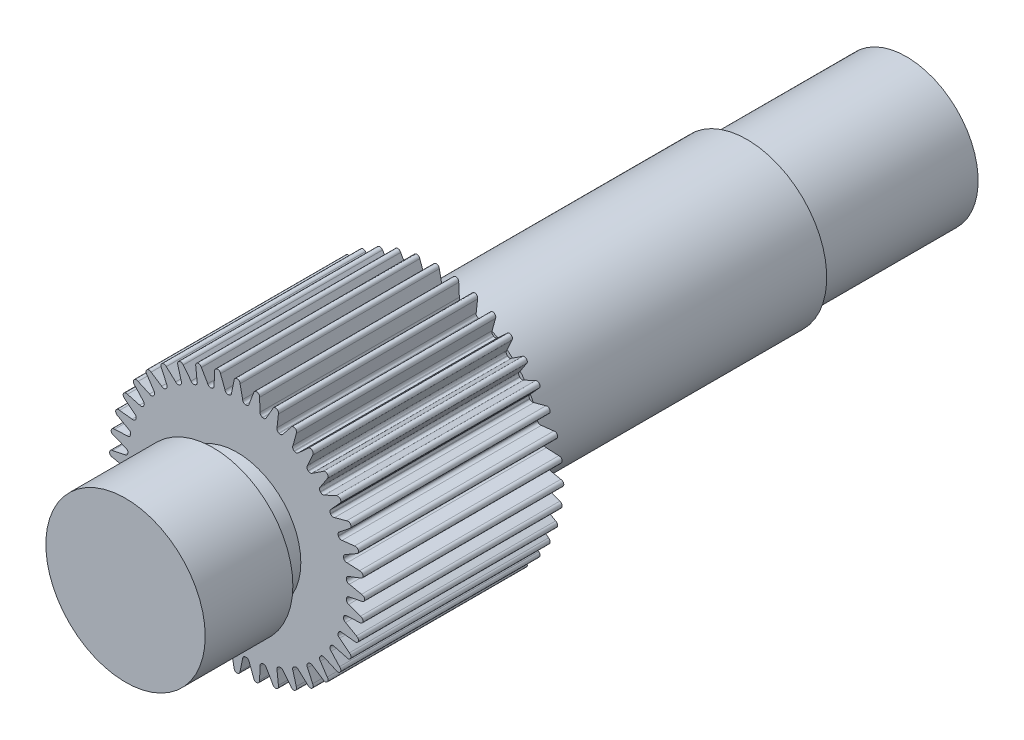
from build123d import *

# Parameters (mm, degrees)
SKETCH1_R            = 32
BOSS_EXTRUDE1_DEPTH  = 196
SKETCH2_OUTSIDE_W    = 109.178
SKETCH2_OUTSIDE_H    = 109.178
SKETCH2_OUTSIDE_R    = 20
CUT_EXTRUDE1_DEPTH   = 22
SKETCH3_OUTSIDE_W    = 109.178
SKETCH3_OUTSIDE_H    = 109.178
SKETCH3_OUTSIDE_R    = 16
CUT_EXTRUDE2_DEPTH   = 6
CUT_EXTRUDE3_START   = -197
CUT_EXTRUDE3_DEPTH   = 170
SKETCH5_OUTSIDE_W    = 109.178
SKETCH5_OUTSIDE_H    = 109.178
SKETCH5_OUTSIDE_R    = 20
CUT_EXTRUDE4_DEPTH   = 118
SKETCH6_OUTSIDE_W    = 109.178
SKETCH6_OUTSIDE_H    = 109.178
SKETCH6_OUTSIDE_R    = 18
CUT_EXTRUDE5_DEPTH   = 40
SKETCH7_OUTSIDE_W    = 109.178
SKETCH7_OUTSIDE_H    = 109.178
SKETCH7_OUTSIDE_R    = 16
CUT_EXTRUDE7_DEPTH   = 6
CUT_EXTRUDE9_START   = 18.731913592
CUT_EXTRUDE9_DEPTH   = 4.268086408
CUT_EXTRUDE9_START_2 = -14.500000017
CUT_EXTRUDE9_2_DEPTH = 0.708383551
CUT_EXTRUDE9_START_3 = 5.000000004
CUT_EXTRUDE9_3_DEPTH = 21.999999992


with BuildPart() as part:
    # Sketch1 → Boss-Extrude1 (new body)
    with BuildSketch(Plane.XY):
        Circle(SKETCH1_R)
    extrude(amount=BOSS_EXTRUDE1_DEPTH)

    # Sketch2 outside → Cut-Extrude1 (cut)
    with BuildSketch(Plane.XY.offset(196)):
        Rectangle(SKETCH2_OUTSIDE_W, SKETCH2_OUTSIDE_H)
        Circle(SKETCH2_OUTSIDE_R, mode=Mode.SUBTRACT)
    extrude(amount=-CUT_EXTRUDE1_DEPTH, mode=Mode.SUBTRACT)

    # Sketch3 outside → Cut-Extrude2 (cut)
    with BuildSketch(Plane.XY.offset(174)):
        Rectangle(SKETCH3_OUTSIDE_W, SKETCH3_OUTSIDE_H)
        Circle(SKETCH3_OUTSIDE_R, mode=Mode.SUBTRACT)
    extrude(amount=-CUT_EXTRUDE2_DEPTH, mode=Mode.SUBTRACT)

    # Cut-Extrude3: read off the stored shape, not the designer's step
    # Cut-Extrude3 outline → Cut-Extrude3 (cut)
    with BuildSketch(Plane.XY.offset(196).offset(CUT_EXTRUDE3_START)):
        with BuildLine():
            ThreePointArc((31.606026895, 5.005902904), (31.472023396, 4.447738103), (30.982586492, 4.147810777))
            Line((30.982586492, 4.147810777), (28.039781374, 3.02983001))
            ThreePointArc((28.039781374, 3.02983001), (27.567521523, 2.752624649), (27.409573402, 2.22829215))
            ThreePointArc((27.409573402, 2.22829215), (27.415226678, 2.157625132), (27.420697761, 2.086943776))
            ThreePointArc((27.420697761, 2.086943776), (27.658724952, 1.59377521), (28.168534972, 1.393860425))
            Line((28.168534972, 1.393860425), (31.25, 0.75))
            ThreePointArc((31.25, 0.75), (31.780330086, 0.530330086), (32, 0))
            ThreePointArc((32, 0), (31.901354679, 2.510691075), (31.606026895, 5.005902904))
        make_face()
        with BuildLine():
            ThreePointArc((30.747934795, 5.629343288), (31.306099573, 5.495339785), (31.606026895, 5.005902904))
            ThreePointArc((31.606026895, 5.005902904), (31.115837449, 7.47025166), (30.433808518, 9.88854383))
            ThreePointArc((30.433808518, 9.88854383), (30.388771029, 9.316288204), (29.95227888, 8.943488687))
            Line((29.95227888, 8.943488687), (27.220595299, 7.378915973))
            ThreePointArc((27.220595299, 7.378915973), (26.797514223, 7.031245754), (26.72353438, 6.488660128))
            ThreePointArc((26.72353438, 6.488660128), (26.740172811, 6.419747506), (26.756633536, 6.35079222))
            ThreePointArc((26.756633536, 6.35079222), (27.068878778, 5.900931034), (27.603685754, 5.783229389))
            Line((27.603685754, 5.783229389), (30.747934795, 5.629343288))
        make_face()
        with BuildLine():
            ThreePointArc((31.606026895, -5.005902904), (31.901354679, -2.510691075), (32, 0))
            ThreePointArc((32, 0), (31.780330086, -0.530330086), (31.25, -0.75))
            Line((31.25, -0.75), (28.168534972, -1.393860425))
            ThreePointArc((28.168534972, -1.393860425), (27.658724952, -1.59377521), (27.420697761, -2.086943776))
            ThreePointArc((27.420697761, -2.086943776), (27.415226678, -2.157625132), (27.409573402, -2.22829215))
            ThreePointArc((27.409573402, -2.22829215), (27.567521523, -2.752624649), (28.039781374, -3.02983001))
            Line((28.039781374, -3.02983001), (30.982586492, -4.147810777))
            ThreePointArc((30.982586492, -4.147810777), (31.472023396, -4.447738103), (31.606026895, -5.005902904))
        make_face()
        with BuildLine():
            ThreePointArc((29.488753388, 10.370073461), (30.061009004, 10.325035969), (30.433808518, 9.888543829))
            ThreePointArc((30.433808518, 9.888543829), (29.564145038, 12.24586984), (28.512208774, 14.527695992))
            ThreePointArc((28.512208774, 14.527695992), (28.557246268, 13.955440371), (28.184446756, 13.518948224))
            Line((28.184446756, 13.518948224), (25.731147828, 11.546308537))
            ThreePointArc((25.731147828, 11.546308537), (25.367663187, 11.136734253), (25.37947325, 10.589255759))
            ThreePointArc((25.37947325, 10.589255759), (25.406687144, 10.52379439), (25.433732193, 10.458263083))
            ThreePointArc((25.433732193, 10.458263083), (25.812506973, 10.062786352), (26.359142181, 10.030196053))
            Line((26.359142181, 10.030196053), (29.488753388, 10.370073461))
        make_face()
        with BuildLine():
            ThreePointArc((30.433808518, -9.88854383), (31.115837449, -7.47025166), (31.606026895, -5.005902904))
            ThreePointArc((31.606026895, -5.005902904), (31.306099573, -5.495339785), (30.747934795, -5.629343288))
            Line((30.747934795, -5.629343288), (27.603685754, -5.783229389))
            ThreePointArc((27.603685754, -5.783229389), (27.068878778, -5.900931034), (26.756633536, -6.35079222))
            ThreePointArc((26.756633536, -6.35079222), (26.740172811, -6.419747506), (26.72353438, -6.488660128))
            ThreePointArc((26.72353438, -6.488660128), (26.797514223, -7.031245754), (27.220595299, -7.378915973))
            Line((27.220595299, -7.378915973), (29.95227888, -8.943488687))
            ThreePointArc((29.95227888, -8.943488687), (30.388771029, -9.316288204), (30.433808518, -9.88854383))
        make_face()
        with BuildLine():
            ThreePointArc((27.503461006, 14.85545801), (28.075716627, 14.900495504), (28.512208774, 14.527695992))
            ThreePointArc((28.512208774, 14.527695992), (27.284485253, 16.719954081), (25.888543806, 18.809128093))
            ThreePointArc((25.888543806, 18.809128093), (26.022547331, 18.250963297), (25.722620013, 17.761526388))
            Line((25.722620013, 17.761526388), (23.6081141, 15.429392664))
            ThreePointArc((23.6081141, 15.429392664), (23.313176093, 14.967999393), (23.41048526, 14.42910877))
            ThreePointArc((23.41048526, 14.42910877), (23.44760452, 14.36871053), (23.484567955, 14.3082168))
            ThreePointArc((23.484567955, 14.3082168), (23.920545579, 13.976862473), (24.465549046, 14.030186001))
            Line((24.465549046, 14.030186001), (27.503461006, 14.85545801))
        make_face()
        with BuildLine():
            ThreePointArc((28.512208774, -14.527695992), (29.564145038, -12.24586984), (30.433808518, -9.88854383))
            ThreePointArc((30.433808518, -9.88854383), (30.061009004, -10.325035969), (29.488753388, -10.370073461))
            Line((29.488753388, -10.370073461), (26.359142181, -10.030196053))
            ThreePointArc((26.359142181, -10.030196053), (25.812506973, -10.062786352), (25.433732193, -10.458263083))
            ThreePointArc((25.433732193, -10.458263083), (25.406687144, -10.52379439), (25.37947325, -10.589255759))
            ThreePointArc((25.37947325, -10.589255759), (25.367663187, -11.136734253), (25.731147828, -11.546308537))
            Line((25.731147828, -11.546308537), (28.184446756, -13.518948224))
            ThreePointArc((28.184446756, -13.518948224), (28.557246268, -13.955440371), (28.512208774, -14.527695992))
        make_face()
        with BuildLine():
            ThreePointArc((24.840942135, 18.97505188), (25.399106911, 19.109055391), (25.888543805, 18.809128093))
            ThreePointArc((25.888543805, 18.809128093), (24.332990891, 20.782337556), (22.627416998, 22.627416998))
            ThreePointArc((22.627416998, 22.627416998), (22.847086912, 22.097086912), (22.627416998, 21.566756826))
            Line((22.627416998, 21.566756826), (20.903770253, 18.932553937))
            ThreePointArc((20.903770253, 18.932553937), (20.684641231, 18.430702714), (20.865053427, 17.913669235))
            ThreePointArc((20.865053427, 17.913669235), (20.911164054, 17.859821329), (20.957135712, 17.805854732))
            ThreePointArc((20.957135712, 17.805854732), (21.439580965, 17.546781854), (21.969532898, 17.684706207))
            Line((21.969532898, 17.684706207), (24.840942135, 18.97505188))
        make_face()
        with BuildLine():
            ThreePointArc((25.888543806, -18.809128093), (27.284485253, -16.719954081), (28.512208774, -14.527695992))
            ThreePointArc((28.512208774, -14.527695992), (28.075716627, -14.900495504), (27.503461006, -14.85545801))
            Line((27.503461006, -14.85545801), (24.465549046, -14.030186001))
            ThreePointArc((24.465549046, -14.030186001), (23.920545579, -13.976862473), (23.484567955, -14.3082168))
            ThreePointArc((23.484567955, -14.3082168), (23.44760452, -14.36871053), (23.41048526, -14.42910877))
            ThreePointArc((23.41048526, -14.42910877), (23.313176093, -14.967999393), (23.6081141, -15.429392664))
            Line((23.6081141, -15.429392664), (25.722620013, -17.761526388))
            ThreePointArc((25.722620013, -17.761526388), (26.022547331, -18.250963297), (25.888543806, -18.809128093))
        make_face()
        with BuildLine():
            ThreePointArc((21.566756826, 22.627416998), (22.097086912, 22.847086912), (22.627416998, 22.627416998))
            ThreePointArc((22.627416998, 22.627416998), (20.782337547, 24.332990899), (18.809128074, 25.88854382))
            ThreePointArc((18.809128074, 25.88854382), (19.10905539, 25.399106923), (18.97505188, 24.840942135))
            Line((18.97505188, 24.840942135), (17.684706207, 21.969532898))
            ThreePointArc((17.684706207, 21.969532898), (17.546781854, 21.439580965), (17.805854732, 20.957135712))
            ThreePointArc((17.805854732, 20.957135712), (17.859821329, 20.911164054), (17.913669235, 20.865053427))
            ThreePointArc((17.913669235, 20.865053427), (18.430702714, 20.684641231), (18.932553937, 20.903770253))
            Line((18.932553937, 20.903770253), (21.566756826, 22.627416998))
        make_face()
        with BuildLine():
            ThreePointArc((22.627416998, -22.627416998), (24.332990891, -20.782337556), (25.888543806, -18.809128093))
            ThreePointArc((25.888543806, -18.809128093), (25.399106911, -19.109055391), (24.840942135, -18.97505188))
            Line((24.840942135, -18.97505188), (21.969532898, -17.684706207))
            ThreePointArc((21.969532898, -17.684706207), (21.439580965, -17.546781854), (20.957135712, -17.805854732))
            ThreePointArc((20.957135712, -17.805854732), (20.911164054, -17.859821329), (20.865053427, -17.913669235))
            ThreePointArc((20.865053427, -17.913669235), (20.684641231, -18.430702714), (20.903770253, -18.932553937))
            Line((20.903770253, -18.932553937), (22.627416998, -21.566756826))
            ThreePointArc((22.627416998, -21.566756826), (22.847086912, -22.097086912), (22.627416998, -22.627416998))
        make_face()
        with BuildLine():
            ThreePointArc((17.761526388, 25.722620013), (18.250963285, 26.02254733), (18.809128074, 25.88854382))
            ThreePointArc((18.809128074, 25.88854382), (16.719954071, 27.284485259), (14.527695992, 28.512208774))
            ThreePointArc((14.527695992, 28.512208774), (14.900495504, 28.075716627), (14.85545801, 27.503461006))
            Line((14.85545801, 27.503461006), (14.030186001, 24.465549046))
            ThreePointArc((14.030186001, 24.465549046), (13.976862473, 23.920545579), (14.3082168, 23.484567955))
            ThreePointArc((14.3082168, 23.484567955), (14.36871053, 23.44760452), (14.42910877, 23.41048526))
            ThreePointArc((14.42910877, 23.41048526), (14.967999393, 23.313176093), (15.429392664, 23.6081141))
            Line((15.429392664, 23.6081141), (17.761526388, 25.722620013))
        make_face()
        with BuildLine():
            ThreePointArc((18.809128042, -25.888543843), (20.782337532, -24.332990912), (22.627416998, -22.627416998))
            ThreePointArc((22.627416998, -22.627416998), (22.097086912, -22.847086912), (21.566756826, -22.627416998))
            Line((21.566756826, -22.627416998), (18.932553937, -20.903770253))
            ThreePointArc((18.932553937, -20.903770253), (18.430702714, -20.684641231), (17.913669235, -20.865053427))
            ThreePointArc((17.913669235, -20.865053427), (17.859821329, -20.911164054), (17.805854732, -20.957135712))
            ThreePointArc((17.805854732, -20.957135712), (17.546781854, -21.439580965), (17.684706207, -21.969532898))
            Line((17.684706207, -21.969532898), (18.97505188, -24.840942135))
            ThreePointArc((18.97505188, -24.840942135), (19.109055386, -25.399106942), (18.809128042, -25.888543843))
        make_face()
        with BuildLine():
            ThreePointArc((13.518948224, 28.184446756), (13.955440371, 28.557246268), (14.527695992, 28.512208774))
            ThreePointArc((14.527695992, 28.512208774), (12.245869829, 29.564145043), (9.888543807, 30.433808526))
            ThreePointArc((9.888543807, 30.433808526), (10.325035964, 30.061009015), (10.370073461, 29.488753388))
            Line((10.370073461, 29.488753388), (10.030196053, 26.359142181))
            ThreePointArc((10.030196053, 26.359142181), (10.062786352, 25.812506973), (10.458263083, 25.433732193))
            ThreePointArc((10.458263083, 25.433732193), (10.52379439, 25.406687144), (10.589255759, 25.37947325))
            ThreePointArc((10.589255759, 25.37947325), (11.136734253, 25.367663187), (11.546308537, 25.731147828))
            Line((11.546308537, 25.731147828), (13.518948224, 28.184446756))
        make_face()
        with BuildLine():
            ThreePointArc((14.527695992, -28.512208774), (16.719954055, -27.284485269), (18.809128042, -25.888543843))
            ThreePointArc((18.809128042, -25.888543843), (18.250963266, -26.022547326), (17.761526388, -25.722620013))
            Line((17.761526388, -25.722620013), (15.429392664, -23.6081141))
            ThreePointArc((15.429392664, -23.6081141), (14.967999393, -23.313176093), (14.42910877, -23.41048526))
            ThreePointArc((14.42910877, -23.41048526), (14.36871053, -23.44760452), (14.3082168, -23.484567955))
            ThreePointArc((14.3082168, -23.484567955), (13.976862473, -23.920545579), (14.030186001, -24.465549046))
            Line((14.030186001, -24.465549046), (14.85545801, -27.503461006))
            ThreePointArc((14.85545801, -27.503461006), (14.900495504, -28.075716627), (14.527695992, -28.512208774))
        make_face()
        with BuildLine():
            ThreePointArc((8.943488687, 29.95227888), (9.316288193, 30.388771024), (9.888543807, 30.433808525))
            ThreePointArc((9.888543807, 30.433808525), (7.470251648, 31.115837452), (5.005902904, 31.606026895))
            ThreePointArc((5.005902904, 31.606026895), (5.495339785, 31.306099573), (5.629343288, 30.747934795))
            Line((5.629343288, 30.747934795), (5.783229389, 27.603685754))
            ThreePointArc((5.783229389, 27.603685754), (5.900931034, 27.068878778), (6.35079222, 26.756633536))
            ThreePointArc((6.35079222, 26.756633536), (6.419747506, 26.740172811), (6.488660128, 26.72353438))
            ThreePointArc((6.488660128, 26.72353438), (7.031245754, 26.797514223), (7.378915973, 27.220595299))
            Line((7.378915973, 27.220595299), (8.943488687, 29.95227888))
        make_face()
        with BuildLine():
            ThreePointArc((9.88854383, -30.433808518), (12.24586984, -29.564145038), (14.527695992, -28.512208774))
            ThreePointArc((14.527695992, -28.512208774), (13.955440371, -28.557246268), (13.518948224, -28.184446756))
            Line((13.518948224, -28.184446756), (11.546308537, -25.731147828))
            ThreePointArc((11.546308537, -25.731147828), (11.136734253, -25.367663187), (10.589255759, -25.37947325))
            ThreePointArc((10.589255759, -25.37947325), (10.52379439, -25.406687144), (10.458263083, -25.433732193))
            ThreePointArc((10.458263083, -25.433732193), (10.062786352, -25.812506973), (10.030196053, -26.359142181))
            Line((10.030196053, -26.359142181), (10.370073461, -29.488753388))
            ThreePointArc((10.370073461, -29.488753388), (10.325035969, -30.061009004), (9.88854383, -30.433808518))
        make_face()
        with BuildLine():
            ThreePointArc((4.147810777, 30.982586492), (4.447738103, 31.472023396), (5.005902904, 31.606026895))
            ThreePointArc((5.005902904, 31.606026895), (2.510691075, 31.901354679), (0, 32))
            ThreePointArc((0, 32), (0.530330086, 31.780330086), (0.75, 31.25))
            Line((0.75, 31.25), (1.393860425, 28.168534972))
            ThreePointArc((1.393860425, 28.168534972), (1.59377521, 27.658724952), (2.086943776, 27.420697761))
            ThreePointArc((2.086943776, 27.420697761), (2.157625132, 27.415226678), (2.22829215, 27.409573402))
            ThreePointArc((2.22829215, 27.409573402), (2.752624649, 27.567521523), (3.02983001, 28.039781374))
            Line((3.02983001, 28.039781374), (4.147810777, 30.982586492))
        make_face()
        with BuildLine():
            ThreePointArc((5.005902904, -31.606026895), (7.47025166, -31.115837449), (9.88854383, -30.433808518))
            ThreePointArc((9.88854383, -30.433808518), (9.316288204, -30.388771029), (8.943488687, -29.95227888))
            Line((8.943488687, -29.95227888), (7.378915973, -27.220595299))
            ThreePointArc((7.378915973, -27.220595299), (7.031245754, -26.797514223), (6.488660128, -26.72353438))
            ThreePointArc((6.488660128, -26.72353438), (6.419747506, -26.740172811), (6.35079222, -26.756633536))
            ThreePointArc((6.35079222, -26.756633536), (5.900931034, -27.068878778), (5.783229389, -27.603685754))
            Line((5.783229389, -27.603685754), (5.629343288, -30.747934795))
            ThreePointArc((5.629343288, -30.747934795), (5.495339785, -31.306099573), (5.005902904, -31.606026895))
        make_face()
        with BuildLine():
            ThreePointArc((-0.75, 31.25), (-0.530330086, 31.780330086), (0, 32))
            ThreePointArc((0, 32), (-2.510691075, 31.901354679), (-5.005902904, 31.606026895))
            ThreePointArc((-5.005902904, 31.606026895), (-4.447738103, 31.472023396), (-4.147810777, 30.982586492))
            Line((-4.147810777, 30.982586492), (-3.02983001, 28.039781374))
            ThreePointArc((-3.02983001, 28.039781374), (-2.752624649, 27.567521523), (-2.22829215, 27.409573402))
            ThreePointArc((-2.22829215, 27.409573402), (-2.157625132, 27.415226678), (-2.086943776, 27.420697761))
            ThreePointArc((-2.086943776, 27.420697761), (-1.59377521, 27.658724952), (-1.393860425, 28.168534972))
            Line((-1.393860425, 28.168534972), (-0.75, 31.25))
        make_face()
        with BuildLine():
            ThreePointArc((0, -32), (2.510691075, -31.901354679), (5.005902904, -31.606026895))
            ThreePointArc((5.005902904, -31.606026895), (4.447738103, -31.472023396), (4.147810777, -30.982586492))
            Line((4.147810777, -30.982586492), (3.02983001, -28.039781374))
            ThreePointArc((3.02983001, -28.039781374), (2.752624649, -27.567521523), (2.22829215, -27.409573402))
            ThreePointArc((2.22829215, -27.409573402), (2.157625132, -27.415226678), (2.086943776, -27.420697761))
            ThreePointArc((2.086943776, -27.420697761), (1.59377521, -27.658724952), (1.393860425, -28.168534972))
            Line((1.393860425, -28.168534972), (0.75, -31.25))
            ThreePointArc((0.75, -31.25), (0.530330086, -31.780330086), (0, -32))
        make_face()
        with BuildLine():
            ThreePointArc((-5.629343288, 30.747934795), (-5.495339785, 31.306099573), (-5.005902904, 31.606026895))
            ThreePointArc((-5.005902904, 31.606026895), (-7.47025166, 31.115837449), (-9.88854383, 30.433808518))
            ThreePointArc((-9.88854383, 30.433808518), (-9.316288204, 30.388771029), (-8.943488687, 29.95227888))
            Line((-8.943488687, 29.95227888), (-7.378915973, 27.220595299))
            ThreePointArc((-7.378915973, 27.220595299), (-7.031245754, 26.797514223), (-6.488660128, 26.72353438))
            ThreePointArc((-6.488660128, 26.72353438), (-6.419747506, 26.740172811), (-6.35079222, 26.756633536))
            ThreePointArc((-6.35079222, 26.756633536), (-5.900931034, 27.068878778), (-5.783229389, 27.603685754))
            Line((-5.783229389, 27.603685754), (-5.629343288, 30.747934795))
        make_face()
        with BuildLine():
            ThreePointArc((-5.005902904, -31.606026895), (-2.510691075, -31.901354679), (0, -32))
            ThreePointArc((0, -32), (-0.530330086, -31.780330086), (-0.75, -31.25))
            Line((-0.75, -31.25), (-1.393860425, -28.168534972))
            ThreePointArc((-1.393860425, -28.168534972), (-1.59377521, -27.658724952), (-2.086943776, -27.420697761))
            ThreePointArc((-2.086943776, -27.420697761), (-2.157625132, -27.415226678), (-2.22829215, -27.409573402))
            ThreePointArc((-2.22829215, -27.409573402), (-2.752624649, -27.567521523), (-3.02983001, -28.039781374))
            Line((-3.02983001, -28.039781374), (-4.147810777, -30.982586492))
            ThreePointArc((-4.147810777, -30.982586492), (-4.447738103, -31.472023396), (-5.005902904, -31.606026895))
        make_face()
        with BuildLine():
            ThreePointArc((-10.370073461, 29.488753388), (-10.325035969, 30.061009004), (-9.888543829, 30.433808518))
            ThreePointArc((-9.888543829, 30.433808518), (-12.24586984, 29.564145038), (-14.527695992, 28.512208774))
            ThreePointArc((-14.527695992, 28.512208774), (-13.955440371, 28.557246268), (-13.518948224, 28.184446756))
            Line((-13.518948224, 28.184446756), (-11.546308537, 25.731147828))
            ThreePointArc((-11.546308537, 25.731147828), (-11.136734253, 25.367663187), (-10.589255759, 25.37947325))
            ThreePointArc((-10.589255759, 25.37947325), (-10.52379439, 25.406687144), (-10.458263083, 25.433732193))
            ThreePointArc((-10.458263083, 25.433732193), (-10.062786352, 25.812506973), (-10.030196053, 26.359142181))
            Line((-10.030196053, 26.359142181), (-10.370073461, 29.488753388))
        make_face()
        with BuildLine():
            ThreePointArc((-9.88854383, -30.433808518), (-7.47025166, -31.115837449), (-5.005902904, -31.606026895))
            ThreePointArc((-5.005902904, -31.606026895), (-5.495339785, -31.306099573), (-5.629343288, -30.747934795))
            Line((-5.629343288, -30.747934795), (-5.783229389, -27.603685754))
            ThreePointArc((-5.783229389, -27.603685754), (-5.900931034, -27.068878778), (-6.35079222, -26.756633536))
            ThreePointArc((-6.35079222, -26.756633536), (-6.419747506, -26.740172811), (-6.488660128, -26.72353438))
            ThreePointArc((-6.488660128, -26.72353438), (-7.031245754, -26.797514223), (-7.378915973, -27.220595299))
            Line((-7.378915973, -27.220595299), (-8.943488687, -29.95227888))
            ThreePointArc((-8.943488687, -29.95227888), (-9.316288204, -30.388771029), (-9.88854383, -30.433808518))
        make_face()
        with BuildLine():
            ThreePointArc((-14.85545801, 27.503461006), (-14.900495504, 28.075716627), (-14.527695992, 28.512208774))
            ThreePointArc((-14.527695992, 28.512208774), (-16.719954081, 27.284485253), (-18.809128093, 25.888543806))
            ThreePointArc((-18.809128093, 25.888543806), (-18.250963297, 26.022547331), (-17.761526388, 25.722620013))
            Line((-17.761526388, 25.722620013), (-15.429392664, 23.6081141))
            ThreePointArc((-15.429392664, 23.6081141), (-14.967999393, 23.313176093), (-14.42910877, 23.41048526))
            ThreePointArc((-14.42910877, 23.41048526), (-14.36871053, 23.44760452), (-14.3082168, 23.484567955))
            ThreePointArc((-14.3082168, 23.484567955), (-13.976862473, 23.920545579), (-14.030186001, 24.465549046))
            Line((-14.030186001, 24.465549046), (-14.85545801, 27.503461006))
        make_face()
        with BuildLine():
            ThreePointArc((-14.527695992, -28.512208774), (-12.24586984, -29.564145038), (-9.88854383, -30.433808518))
            ThreePointArc((-9.88854383, -30.433808518), (-10.325035969, -30.061009004), (-10.370073461, -29.488753388))
            Line((-10.370073461, -29.488753388), (-10.030196053, -26.359142181))
            ThreePointArc((-10.030196053, -26.359142181), (-10.062786352, -25.812506973), (-10.458263083, -25.433732193))
            ThreePointArc((-10.458263083, -25.433732193), (-10.52379439, -25.406687144), (-10.589255759, -25.37947325))
            ThreePointArc((-10.589255759, -25.37947325), (-11.136734253, -25.367663187), (-11.546308537, -25.731147828))
            Line((-11.546308537, -25.731147828), (-13.518948224, -28.184446756))
            ThreePointArc((-13.518948224, -28.184446756), (-13.955440371, -28.557246268), (-14.527695992, -28.512208774))
        make_face()
        with BuildLine():
            ThreePointArc((-18.97505188, 24.840942135), (-19.109055391, 25.399106911), (-18.809128093, 25.888543805))
            ThreePointArc((-18.809128093, 25.888543805), (-20.782337556, 24.332990891), (-22.627416998, 22.627416998))
            ThreePointArc((-22.627416998, 22.627416998), (-22.097086912, 22.847086912), (-21.566756826, 22.627416998))
            Line((-21.566756826, 22.627416998), (-18.932553937, 20.903770253))
            ThreePointArc((-18.932553937, 20.903770253), (-18.430702714, 20.684641231), (-17.913669235, 20.865053427))
            ThreePointArc((-17.913669235, 20.865053427), (-17.859821329, 20.911164054), (-17.805854732, 20.957135712))
            ThreePointArc((-17.805854732, 20.957135712), (-17.546781854, 21.439580965), (-17.684706207, 21.969532898))
            Line((-17.684706207, 21.969532898), (-18.97505188, 24.840942135))
        make_face()
        with BuildLine():
            ThreePointArc((-18.809128042, -25.888543843), (-16.719954055, -27.284485269), (-14.527695992, -28.512208774))
            ThreePointArc((-14.527695992, -28.512208774), (-14.900495504, -28.075716627), (-14.85545801, -27.503461006))
            Line((-14.85545801, -27.503461006), (-14.030186001, -24.465549046))
            ThreePointArc((-14.030186001, -24.465549046), (-13.976862473, -23.920545579), (-14.3082168, -23.484567955))
            ThreePointArc((-14.3082168, -23.484567955), (-14.36871053, -23.44760452), (-14.42910877, -23.41048526))
            ThreePointArc((-14.42910877, -23.41048526), (-14.967999393, -23.313176093), (-15.429392664, -23.6081141))
            Line((-15.429392664, -23.6081141), (-17.761526388, -25.722620013))
            ThreePointArc((-17.761526388, -25.722620013), (-18.250963266, -26.022547326), (-18.809128042, -25.888543843))
        make_face()
        with BuildLine():
            ThreePointArc((-22.627416998, 21.566756826), (-22.847086912, 22.097086912), (-22.627416998, 22.627416998))
            ThreePointArc((-22.627416998, 22.627416998), (-24.332990912, 20.782337532), (-25.888543843, 18.809128042))
            ThreePointArc((-25.888543843, 18.809128042), (-25.399106942, 19.109055386), (-24.840942135, 18.97505188))
            Line((-24.840942135, 18.97505188), (-21.969532898, 17.684706207))
            ThreePointArc((-21.969532898, 17.684706207), (-21.439580965, 17.546781854), (-20.957135712, 17.805854732))
            ThreePointArc((-20.957135712, 17.805854732), (-20.911164054, 17.859821329), (-20.865053427, 17.913669235))
            ThreePointArc((-20.865053427, 17.913669235), (-20.684641231, 18.430702714), (-20.903770253, 18.932553937))
            Line((-20.903770253, 18.932553937), (-22.627416998, 21.566756826))
        make_face()
        with BuildLine():
            ThreePointArc((-22.627416998, -22.627416998), (-20.782337532, -24.332990912), (-18.809128042, -25.888543843))
            ThreePointArc((-18.809128042, -25.888543843), (-19.109055386, -25.399106942), (-18.97505188, -24.840942135))
            Line((-18.97505188, -24.840942135), (-17.684706207, -21.969532898))
            ThreePointArc((-17.684706207, -21.969532898), (-17.546781854, -21.439580965), (-17.805854732, -20.957135712))
            ThreePointArc((-17.805854732, -20.957135712), (-17.859821329, -20.911164054), (-17.913669235, -20.865053427))
            ThreePointArc((-17.913669235, -20.865053427), (-18.430702714, -20.684641231), (-18.932553937, -20.903770253))
            Line((-18.932553937, -20.903770253), (-21.566756826, -22.627416998))
            ThreePointArc((-21.566756826, -22.627416998), (-22.097086912, -22.847086912), (-22.627416998, -22.627416998))
        make_face()
        with BuildLine():
            ThreePointArc((-25.722620013, 17.761526388), (-26.022547326, 18.250963266), (-25.888543842, 18.809128042))
            ThreePointArc((-25.888543842, 18.809128042), (-27.284485269, 16.719954055), (-28.512208774, 14.527695992))
            ThreePointArc((-28.512208774, 14.527695992), (-28.075716627, 14.900495504), (-27.503461006, 14.85545801))
            Line((-27.503461006, 14.85545801), (-24.465549046, 14.030186001))
            ThreePointArc((-24.465549046, 14.030186001), (-23.920545579, 13.976862473), (-23.484567955, 14.3082168))
            ThreePointArc((-23.484567955, 14.3082168), (-23.44760452, 14.36871053), (-23.41048526, 14.42910877))
            ThreePointArc((-23.41048526, 14.42910877), (-23.313176093, 14.967999393), (-23.6081141, 15.429392664))
            Line((-23.6081141, 15.429392664), (-25.722620013, 17.761526388))
        make_face()
        with BuildLine():
            ThreePointArc((-25.888543828, -18.809128062), (-24.332990904, -20.782337541), (-22.627416998, -22.627416998))
            ThreePointArc((-22.627416998, -22.627416998), (-22.847086912, -22.097086912), (-22.627416998, -21.566756826))
            Line((-22.627416998, -21.566756826), (-20.903770253, -18.932553937))
            ThreePointArc((-20.903770253, -18.932553937), (-20.684641231, -18.430702714), (-20.865053427, -17.913669235))
            ThreePointArc((-20.865053427, -17.913669235), (-20.911164054, -17.859821329), (-20.957135712, -17.805854732))
            ThreePointArc((-20.957135712, -17.805854732), (-21.439580965, -17.546781854), (-21.969532898, -17.684706207))
            Line((-21.969532898, -17.684706207), (-24.840942135, -18.97505188))
            ThreePointArc((-24.840942135, -18.97505188), (-25.39910693, -19.109055388), (-25.888543828, -18.809128062))
        make_face()
        with BuildLine():
            ThreePointArc((-28.184446756, 13.518948224), (-28.557246268, 13.955440371), (-28.512208774, 14.527695992))
            ThreePointArc((-28.512208774, 14.527695992), (-29.564145038, 12.24586984), (-30.433808518, 9.88854383))
            ThreePointArc((-30.433808518, 9.88854383), (-30.061009004, 10.325035969), (-29.488753388, 10.370073461))
            Line((-29.488753388, 10.370073461), (-26.359142181, 10.030196053))
            ThreePointArc((-26.359142181, 10.030196053), (-25.812506973, 10.062786352), (-25.433732193, 10.458263083))
            ThreePointArc((-25.433732193, 10.458263083), (-25.406687144, 10.52379439), (-25.37947325, 10.589255759))
            ThreePointArc((-25.37947325, 10.589255759), (-25.367663187, 11.136734253), (-25.731147828, 11.546308537))
            Line((-25.731147828, 11.546308537), (-28.184446756, 13.518948224))
        make_face()
        with BuildLine():
            ThreePointArc((-28.512208774, -14.527695992), (-27.284485263, -16.719954065), (-25.888543828, -18.809128062))
            ThreePointArc((-25.888543828, -18.809128062), (-26.022547328, -18.250963278), (-25.722620013, -17.761526388))
            Line((-25.722620013, -17.761526388), (-23.6081141, -15.429392664))
            ThreePointArc((-23.6081141, -15.429392664), (-23.313176093, -14.967999393), (-23.41048526, -14.42910877))
            ThreePointArc((-23.41048526, -14.42910877), (-23.44760452, -14.36871053), (-23.484567955, -14.3082168))
            ThreePointArc((-23.484567955, -14.3082168), (-23.920545579, -13.976862473), (-24.465549046, -14.030186001))
            Line((-24.465549046, -14.030186001), (-27.503461006, -14.85545801))
            ThreePointArc((-27.503461006, -14.85545801), (-28.075716627, -14.900495504), (-28.512208774, -14.527695992))
        make_face()
        with BuildLine():
            ThreePointArc((-29.95227888, 8.943488687), (-30.388771029, 9.316288204), (-30.433808518, 9.888543829))
            ThreePointArc((-30.433808518, 9.888543829), (-31.115837454, 7.470251638), (-31.606026902, 5.005902861))
            ThreePointArc((-31.606026902, 5.005902861), (-31.306099591, 5.495339772), (-30.747934795, 5.629343288))
            Line((-30.747934795, 5.629343288), (-27.603685754, 5.783229389))
            ThreePointArc((-27.603685754, 5.783229389), (-27.068878778, 5.900931034), (-26.756633536, 6.35079222))
            ThreePointArc((-26.756633536, 6.35079222), (-26.740172811, 6.419747506), (-26.72353438, 6.488660128))
            ThreePointArc((-26.72353438, 6.488660128), (-26.797514223, 7.031245754), (-27.220595299, 7.378915973))
            Line((-27.220595299, 7.378915973), (-29.95227888, 8.943488687))
        make_face()
        with BuildLine():
            ThreePointArc((-30.433808518, -9.88854383), (-29.564145038, -12.24586984), (-28.512208774, -14.527695992))
            ThreePointArc((-28.512208774, -14.527695992), (-28.557246268, -13.955440371), (-28.184446756, -13.518948224))
            Line((-28.184446756, -13.518948224), (-25.731147828, -11.546308537))
            ThreePointArc((-25.731147828, -11.546308537), (-25.367663187, -11.136734253), (-25.37947325, -10.589255759))
            ThreePointArc((-25.37947325, -10.589255759), (-25.406687144, -10.52379439), (-25.433732193, -10.458263083))
            ThreePointArc((-25.433732193, -10.458263083), (-25.812506973, -10.062786352), (-26.359142181, -10.030196053))
            Line((-26.359142181, -10.030196053), (-29.488753388, -10.370073461))
            ThreePointArc((-29.488753388, -10.370073461), (-30.061009004, -10.325035969), (-30.433808518, -9.88854383))
        make_face()
        with BuildLine():
            ThreePointArc((-30.982586492, 4.147810777), (-31.472023383, 4.447738085), (-31.606026902, 5.005902861))
            ThreePointArc((-31.606026902, 5.005902861), (-31.90135468, 2.510691053), (-32, 0))
            ThreePointArc((-32, 0), (-31.780330086, 0.530330086), (-31.25, 0.75))
            Line((-31.25, 0.75), (-28.168534972, 1.393860425))
            ThreePointArc((-28.168534972, 1.393860425), (-27.658724952, 1.59377521), (-27.420697761, 2.086943776))
            ThreePointArc((-27.420697761, 2.086943776), (-27.415226678, 2.157625132), (-27.409573402, 2.22829215))
            ThreePointArc((-27.409573402, 2.22829215), (-27.567521523, 2.752624649), (-28.039781374, 3.02983001))
            Line((-28.039781374, 3.02983001), (-30.982586492, 4.147810777))
        make_face()
        with BuildLine():
            ThreePointArc((-31.606026895, -5.005902904), (-31.115837449, -7.47025166), (-30.433808518, -9.88854383))
            ThreePointArc((-30.433808518, -9.88854383), (-30.388771029, -9.316288204), (-29.95227888, -8.943488687))
            Line((-29.95227888, -8.943488687), (-27.220595299, -7.378915973))
            ThreePointArc((-27.220595299, -7.378915973), (-26.797514223, -7.031245754), (-26.72353438, -6.488660128))
            ThreePointArc((-26.72353438, -6.488660128), (-26.740172811, -6.419747506), (-26.756633536, -6.35079222))
            ThreePointArc((-26.756633536, -6.35079222), (-27.068878778, -5.900931034), (-27.603685754, -5.783229389))
            Line((-27.603685754, -5.783229389), (-30.747934795, -5.629343288))
            ThreePointArc((-30.747934795, -5.629343288), (-31.306099573, -5.495339785), (-31.606026895, -5.005902904))
        make_face()
        with BuildLine():
            ThreePointArc((-31.25, -0.75), (-31.780330086, -0.530330086), (-32, 0))
            ThreePointArc((-32, 0), (-31.901354679, -2.510691075), (-31.606026895, -5.005902904))
            ThreePointArc((-31.606026895, -5.005902904), (-31.472023396, -4.447738103), (-30.982586492, -4.147810777))
            Line((-30.982586492, -4.147810777), (-28.039781374, -3.02983001))
            ThreePointArc((-28.039781374, -3.02983001), (-27.567521523, -2.752624649), (-27.409573402, -2.22829215))
            ThreePointArc((-27.409573402, -2.22829215), (-27.415226678, -2.157625132), (-27.420697761, -2.086943776))
            ThreePointArc((-27.420697761, -2.086943776), (-27.658724952, -1.59377521), (-28.168534972, -1.393860425))
            Line((-28.168534972, -1.393860425), (-31.25, -0.75))
        make_face()
    extrude(amount=CUT_EXTRUDE3_DEPTH, mode=Mode.SUBTRACT)

    # Sketch5 outside → Cut-Extrude4 (cut)
    with BuildSketch(Plane(origin=(0, 0, 0), x_dir=(-1, 0, 0), z_dir=(0, 0, -1))):
        Rectangle(SKETCH5_OUTSIDE_W, SKETCH5_OUTSIDE_H)
        with Locations(Location((0, 0, 0), (0, 0, 180))):
            Circle(SKETCH5_OUTSIDE_R, mode=Mode.SUBTRACT)
    extrude(amount=-CUT_EXTRUDE4_DEPTH, mode=Mode.SUBTRACT)

    # Sketch6 outside → Cut-Extrude5 (cut)
    with BuildSketch(Plane(origin=(0, 0, 0), x_dir=(-1, 0, 0), z_dir=(0, 0, -1))):
        Rectangle(SKETCH6_OUTSIDE_W, SKETCH6_OUTSIDE_H)
        Circle(SKETCH6_OUTSIDE_R, mode=Mode.SUBTRACT)
    extrude(amount=-CUT_EXTRUDE5_DEPTH, mode=Mode.SUBTRACT)

    # Sketch7 outside → Cut-Extrude7 (cut)
    with BuildSketch(Plane(origin=(0, 0, 112), x_dir=(-1, 0, 0), z_dir=(0, 0, -1))):
        Rectangle(SKETCH7_OUTSIDE_W, SKETCH7_OUTSIDE_H)
        with Locations(Location((0, 0, 0), (0, 0, 180))):
            Circle(SKETCH7_OUTSIDE_R, mode=Mode.SUBTRACT)
    extrude(amount=-CUT_EXTRUDE7_DEPTH, mode=Mode.SUBTRACT)

    # Cut-Extrude9: read off the stored shape, not the designer's step
    # Cut-Extrude9 outline → Cut-Extrude9 (cut)
    with BuildSketch(Plane(origin=(3.217972329, 2.748408012, 0), x_dir=(0, 0, 1), z_dir=(-0.7604059656000368, -0.6494480483301768, 0)).offset(CUT_EXTRUDE9_START)):
        with BuildLine():
            add(Edge.make_bspline(
                [(22, 5), (23.328095881, 5), (24.618093964, 4.452901083), (26.452693396, 2.61844717), (26.998763295, 1.316136189), (27.001232274, -1.30672288), (26.460913387, -2.609478909), (24.612735711, -4.459006674), (23.32815555, -5), (22, -5)],
                knots=[0, 0, 0, 0, 0.25, 0.25, 0.5, 0.5, 0.75, 0.75, 1, 1, 1, 1], degree=3))
            Line((22, 5), (10, 5))
            add(Edge.make_bspline(
                [(10, -5), (8.671904119, -5), (7.381906036, -4.452901083), (5.547306604, -2.61844717), (5.001236705, -1.316136189), (4.998767726, 1.30672288), (5.539086613, 2.609478909), (7.387264289, 4.459006674), (8.67184445, 5), (10, 5)],
                knots=[0, 0, 0, 0, 0.25, 0.25, 0.5, 0.5, 0.75, 0.75, 1, 1, 1, 1], degree=3))
            Line((10, -5), (22, -5))
        make_face()
    extrude(amount=CUT_EXTRUDE9_DEPTH, mode=Mode.SUBTRACT)

    # Cut-Extrude9 2 outline → Cut-Extrude9 2 (cut)
    with BuildSketch(Plane(origin=(0, 0, 0), x_dir=(0.6494480483301768, -0.7604059656000368, 0), z_dir=(0.7604059656000368, 0.6494480483301768, 0)).offset(CUT_EXTRUDE9_START_2)):
        with BuildLine():
            Line((-5, -10), (-5, -22))
            add(Edge.make_bspline(
                [(-5, -22), (-5, -23.328095881), (-4.452901083, -24.618093964), (-2.61844717, -26.452693396), (-1.316136189, -26.998763295), (1.30672288, -27.001232274), (2.609478909, -26.460913387), (4.459006674, -24.612735711), (5, -23.32815555), (5, -22)],
                knots=[0, 0, 0, 0, 0.25, 0.25, 0.5, 0.5, 0.75, 0.75, 1, 1, 1, 1], degree=3))
            Line((5, -22), (5, -10))
            add(Edge.make_bspline(
                [(5, -10), (5, -8.671904119), (4.452901083, -7.381906036), (2.61844717, -5.547306604), (1.316136189, -5.001236705), (-1.30672288, -4.998767726), (-2.609478909, -5.539086613), (-4.459006674, -7.387264289), (-5, -8.67184445), (-5, -10)],
                knots=[0, 0, 0, 0, 0.25, 0.25, 0.5, 0.5, 0.75, 0.75, 1, 1, 1, 1], degree=3))
        make_face()
    extrude(amount=CUT_EXTRUDE9_2_DEPTH, mode=Mode.SUBTRACT)

    # Cut-Extrude9 3 outline → Cut-Extrude9 3 (add)
    with BuildSketch(Plane.XY.offset(CUT_EXTRUDE9_START_3)):
        with BuildLine():
            ThreePointArc((-13.734467678, -5.154908569), (-11.025886501, -9.416996701), (-7.239987194, -12.758968225))
            Line((-7.239987194, -12.758968225), (-13.734467678, -5.154908569))
        make_face()
    extrude(amount=CUT_EXTRUDE9_3_DEPTH)


solid = part.part
